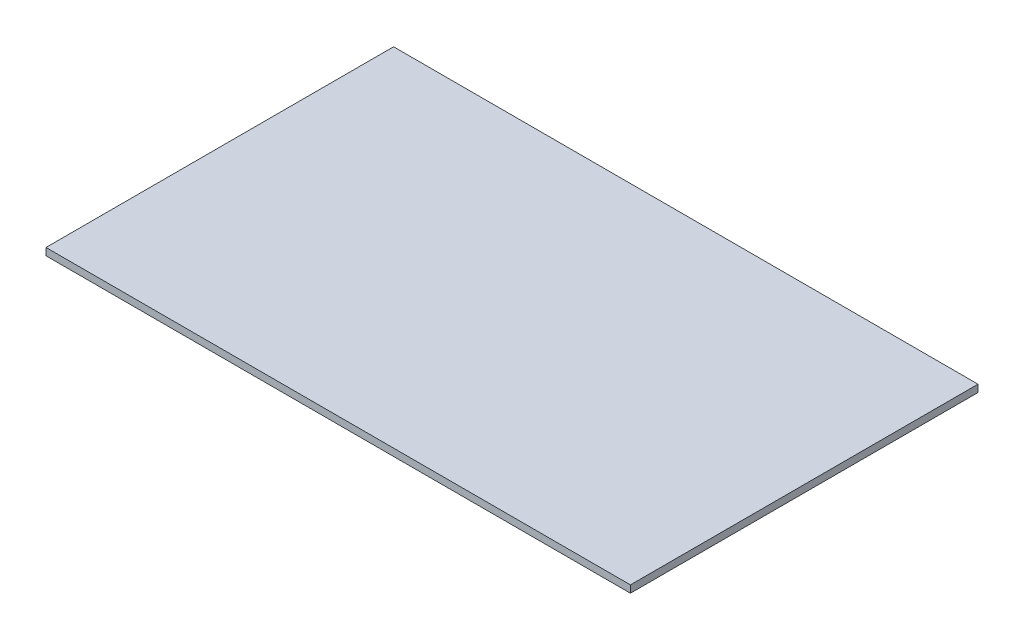
from build123d import *

# Parameters (mm, degrees)
SKETCH1_W           = 256.24282
SKETCH1_H           = 3.175
BOSS_EXTRUDE1_DEPTH = 152.4


with BuildPart() as part:
    # Sketch1 → Boss-Extrude1 (new body)
    with BuildSketch(Plane.XY):
        Rectangle(SKETCH1_W, SKETCH1_H)
    extrude(amount=BOSS_EXTRUDE1_DEPTH)


solid = part.part
